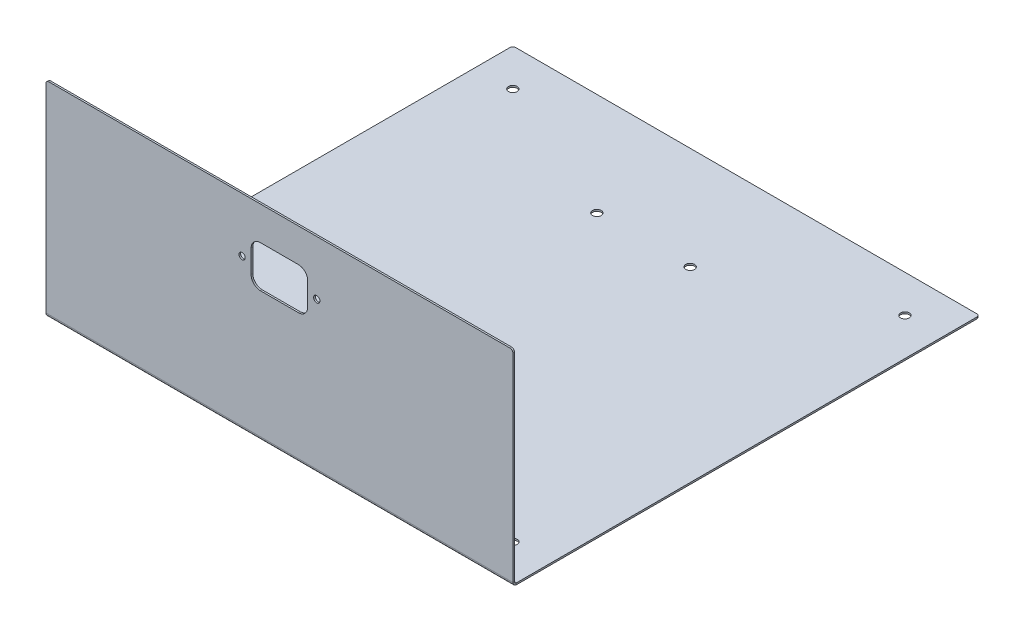
from build123d import *

# Parameters (mm, degrees)
SKETCH1_W              = 250
SKETCH1_H              = 358.226
BASE_FLANGE1_DEPTH     = 0.91
SKETCHED_START         = -125
SKETCHED_BEND1_DEPTH   = 250
SKETCHED_BEND1_2_DEPTH = 250
SKETCH10_R             = 2.35
CUT_EXTRUDE1_DEPTH     = 0.91
FILLET1_R              = 1.5
SKETCH11_R             = 2.35
CUT_EXTRUDE2_DEPTH     = 10
SKETCH12_R             = 1.7
SKETCH12_W             = 30.3
SKETCH12_H             = 22.3
CUT_EXTRUDE3_DEPTH     = 10
FILLET2_R              = 5


# Read off the part's stored shape, not the designer's step: Sketched Bend1
# Sheet-metal steps are written as plain solids
with BuildPart() as part:
    # Sketch1 → Base-Flange1 (new body)
    with BuildSketch(Plane(origin=(0, 0, 0), x_dir=(1, 0, 0), z_dir=(0, 1, 0))):
        Rectangle(SKETCH1_W, SKETCH1_H)
    extrude(amount=-BASE_FLANGE1_DEPTH)

    # Sketched Bend1 outline → Sketched Bend1 (cut)
    with BuildSketch(Plane.YZ.offset(SKETCHED_START)):
        with BuildLine():
            ThreePointArc((-0.91, 68.830699214), (-0.668268616, 69.797195464), (0, 70.536090665))
            Line((0, 70.536090665), (0, 179.113))
            Line((0, 179.113), (-0.91, 179.113))
            Line((-0.91, 179.113), (-0.91, 68.830699214))
        make_face()
    extrude(amount=SKETCHED_BEND1_DEPTH, mode=Mode.SUBTRACT)

    # Sketched Bend1 2 outline → Sketched Bend1 2 (add)
    with BuildSketch(Plane.YZ.offset(SKETCHED_START)):
        with BuildLine():
            Line((109.086699214, 69.973699214), (109.086699214, 70.883699214))
            Line((109.086699214, 70.883699214), (1.143, 70.883699214))
            ThreePointArc((1.143, 70.883699214), (0.545655731, 70.794875587), (0, 70.536090665))
            Line((0, 70.536090665), (0, 68.830699214))
            ThreePointArc((0, 68.830699214), (0.334776949, 69.638922265), (1.143, 69.973699214))
            Line((1.143, 69.973699214), (109.086699214, 69.973699214))
        make_face()
    extrude(amount=SKETCHED_BEND1_2_DEPTH)

    # Sketch10 → Cut-Extrude1 (cut)
    with BuildSketch(Plane(origin=(0, 0, 0), x_dir=(1, 0, 0), z_dir=(0, 1, 0))):
        with Locations(Location((-105, 159.113, 0), (0, 0, 270))):
            Circle(SKETCH10_R)
        with Locations(Location((105, 159.113, 0), (0, 0, 270))):
            Circle(SKETCH10_R)
        with Locations(Location((105, -50.883699214, 0), (0, 0, 270))):
            Circle(SKETCH10_R)
        with Locations(Location((-105, -50.883699214, 0), (0, 0, 270))):
            Circle(SKETCH10_R)
    extrude(amount=-CUT_EXTRUDE1_DEPTH, mode=Mode.SUBTRACT)

    # Fillet1
    fillet1_edges = [part.edges().sort_by_distance(p)[0] for p in [
        (-125, -0.455, -179.113),
        (125, -0.455, -179.113),
        (125, 109.086699214, 70.428699214),
        (-125, 109.086699214, 70.428699214),
    ]]
    fillet(fillet1_edges, radius=FILLET1_R)

    # Sketch11 → Cut-Extrude2 (cut)
    with BuildSketch(Plane(origin=(0, 0, 0), x_dir=(1, 0, 0), z_dir=(0, 1, 0))):
        with Locations(Location((25, 124.113, 0), (0, 0, 270))):
            Circle(SKETCH11_R)
        with Locations(Location((-25, 124.113, 0), (0, 0, 270))):
            Circle(SKETCH11_R)
        with Locations(Location((-25, -25.887, 0), (0, 0, 270))):
            Circle(SKETCH11_R)
        with Locations(Location((25, -25.887, 0), (0, 0, 270))):
            Circle(SKETCH11_R)
    extrude(amount=-CUT_EXTRUDE2_DEPTH, mode=Mode.SUBTRACT)

    # Sketch12 → Cut-Extrude3 (cut)
    with BuildSketch(Plane.XY.offset(70.883699214)):
        with Locations((-20, 80)):
            Circle(SKETCH12_R)
        with Locations((20, 80)):
            Circle(SKETCH12_R)
        with Locations((0, 80)):
            Rectangle(SKETCH12_W, SKETCH12_H)
    extrude(amount=-CUT_EXTRUDE3_DEPTH, mode=Mode.SUBTRACT)

    # Fillet2
    fillet2_edges = [part.edges().sort_by_distance(p)[0] for p in [
        (15.15, 91.15, 70.428699214),
        (15.15, 68.85, 70.428699214),
        (-15.15, 68.85, 70.428699214),
        (-15.15, 91.15, 70.428699214),
    ]]
    fillet(fillet2_edges, radius=FILLET2_R)


solid = part.part
